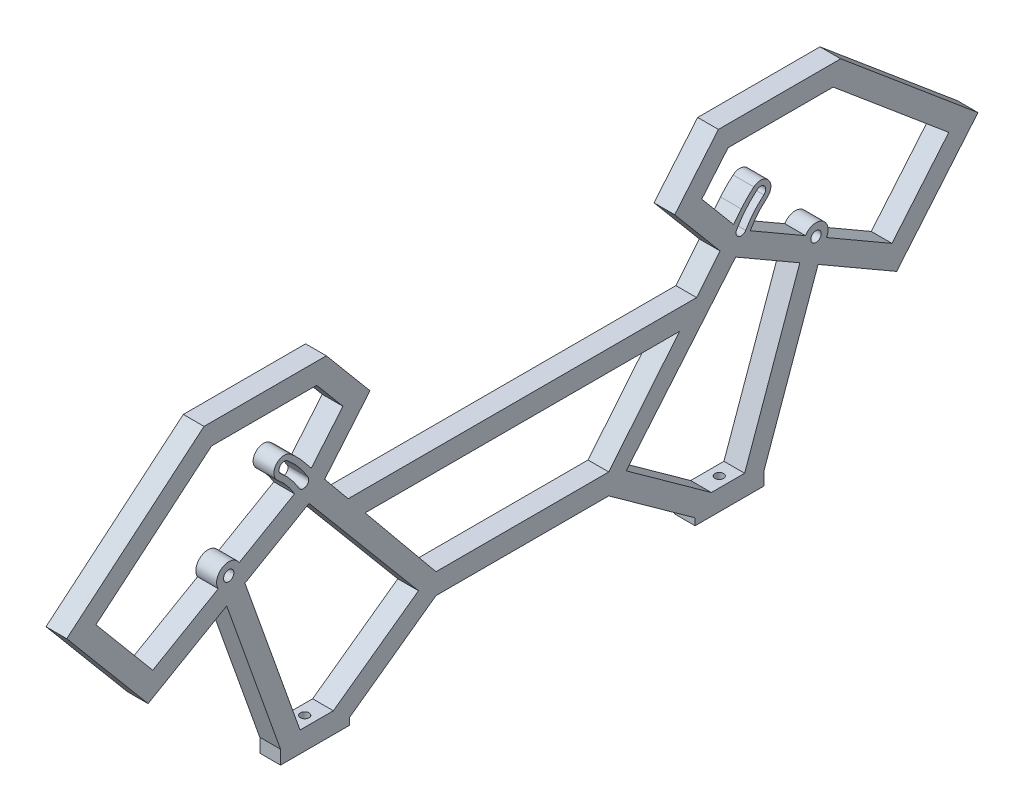
from build123d import *

# Parameters (mm, degrees)
SKETCH1_R           = 1.5
BOSS_EXTRUDE1_DEPTH = 6


with BuildPart() as part:
    # Sketch1 → Boss-Extrude1 (new body)
    with BuildSketch(Plane(origin=(0, 0, 0), x_dir=(0, 0, -1), z_dir=(1, 0, 0))):
        Polygon((50, 0), (70, 0), (70, 4), (85.592625509, 47.729644272), (108.344720621, 34.593716035), (131.887731685, 62.651184052), (92.144160471, 96), (56.74353499, 96), (44.099407436, 80.931315562), (57.225143451, 65.28867251), (50.426653107, 57), (0, 57), (0, 51), (45.505365409, 51), (25, 26), (0, 26), (0, 20), (25, 20), (50, 2), align=None)
        with Locations((85, 55)):
            Circle(SKETCH1_R, mode=Mode.SUBTRACT)
        Polygon((30.059592338, 23.750495981), (61.737302817, 61.50252125), (80.310098668, 50.779512566), (64.343122912, 6), (54.713058978, 6), align=None, mode=Mode.SUBTRACT)
        with BuildLine():
            Line((59.541380939, 90), (51.931851172, 80.931315562))
            Line((51.931851172, 80.931315562), (61.09679395, 70.00896208))
            Line((61.09679395, 70.00896208), (63.350780176, 72.757006533))
            ThreePointArc((63.350780176, 72.757006533), (65.090587223, 74.687947655), (67.001946929, 76.449244407))
            ThreePointArc((67.001946929, 76.449244407), (71.228443087, 76.079473907), (70.858672587, 71.852977749))
            ThreePointArc((70.858672587, 71.852977749), (68.147022251, 69.141327413), (65.947441117, 66))
            Line((65.947441117, 66), (81.968911087, 56.75))
            ThreePointArc((81.968911087, 56.75), (86.75, 58.031088913), (88.031088913, 53.25))
            Line((88.031088913, 53.25), (106.984631039, 42.307167351))
            Line((106.984631039, 42.307167351), (123.434739369, 61.911643051))
            Line((123.434739369, 61.911643051), (89.960339065, 90))
            Line((89.960339065, 90), (59.541380939, 90))
        make_face(mode=Mode.SUBTRACT)
        with BuildLine():
            ThreePointArc((67.966128343, 75.300177743), (64.699822257, 72.033871657), (62.0503268, 68.25))
            ThreePointArc((62.0503268, 68.25), (62.599364905, 66.200961894), (64.648403011, 66.75))
            ThreePointArc((64.648403011, 66.75), (66.997955587, 70.105508828), (69.894491172, 73.002044413))
            ThreePointArc((69.894491172, 73.002044413), (70.079376423, 75.115292493), (67.966128343, 75.300177743))
        make_face(mode=Mode.SUBTRACT)
    boss_extrude1 = extrude(amount=BOSS_EXTRUDE1_DEPTH)

    # Sketch2 → Tap Drill for M3 Tap1 (revolve, cut)
    with BuildSketch(Plane(origin=(3, 0, -60), x_dir=(0, 0, -1), z_dir=(1, 0, 0))):
        Polygon((0, 0), (0, 10.751075774), (1.25, 10), (1.25, 0), align=None)
    tap_drill_for_m3_tap1 = revolve(axis=Axis((3, -6.35, -60), (0, 1, 0)), mode=Mode.SUBTRACT)

    # Mirror1: Boss-Extrude1, Tap Drill for M3 Tap1 across plane
    add(boss_extrude1.mirror(Plane.XY))
    add(tap_drill_for_m3_tap1.mirror(Plane.XY), mode=Mode.SUBTRACT)


solid = part.part
